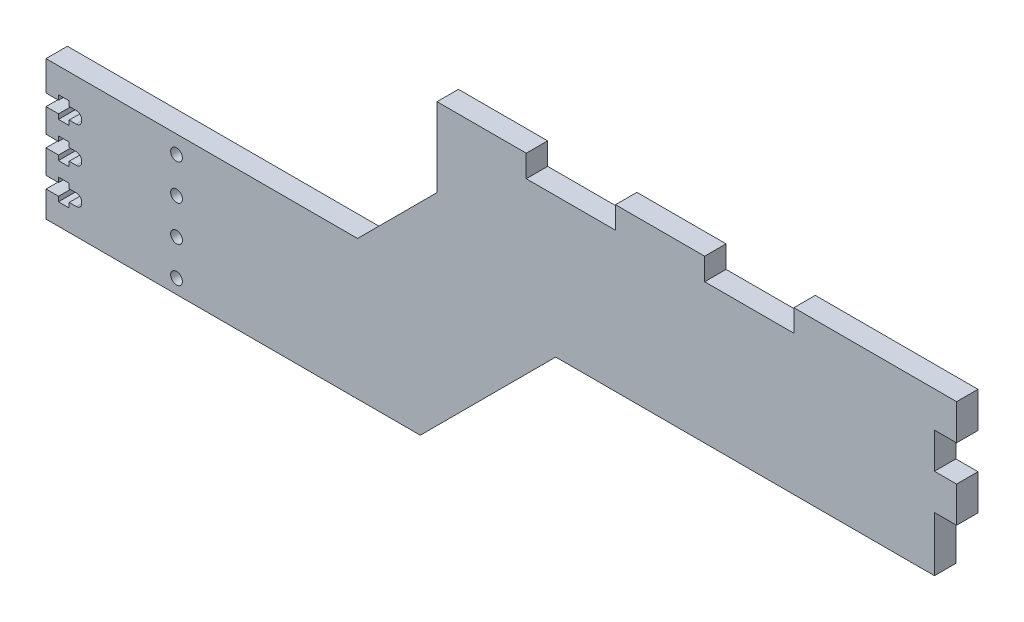
from build123d import *

# Parameters (mm, degrees)
EXTRUDE_1_DEPTH     = 6
SKETCH_2_R          = 1.65
CUT_EXTRUDE_1_DEPTH = 171.71260254


with BuildPart() as part:
    # Эскиз1 → Бобышка-Вытянуть1 (new body)
    with BuildSketch(Plane.XY):
        Polygon((-164.468308742, 1.015256317), (-164.468308742, -37.946418867), (-59.578582118, -37.946418867), (-21.632163251, 0), (84.510530021, 0), (84.510530021, 15.353810043), (90.710530021, 15.353810043), (90.710530021, 25.353810043), (84.510530021, 25.353810043), (84.510530021, 35.353810043), (90.710530021, 35.353810043), (90.710530021, 45.353810043), (45.113947205, 45.353810043), (45.113947205, 39.153810043), (20.113947205, 39.153810043), (20.113947205, 45.353810043), (-4.886052795, 45.353810043), (-4.886052795, 39.153810043), (-29.886052795, 39.153810043), (-29.886052795, 45.353810043), (-54.886052795, 45.353810043), (-54.886052795, 23.298924803), (-77.169721281, 1.015256317), align=None)
    extrude(amount=EXTRUDE_1_DEPTH)

    # Эскиз2 → Вырез-Вытянуть1 (cut, through all)
    with BuildSketch(Plane.XY.offset(6)):
        with Locations((-127.888308742, -3.984743683)):
            Circle(SKETCH_2_R)
        with Locations((-127.888308742, -13.984743683)):
            Circle(SKETCH_2_R)
        with Locations((-127.888308742, -23.984743683)):
            Circle(SKETCH_2_R)
        with Locations((-127.888308742, -33.984743683)):
            Circle(SKETCH_2_R)
        with BuildLine():
            Line((-157.968308742, -10.634743683), (-157.968308742, -11.984743683))
            Line((-157.968308742, -11.984743683), (-160.968308742, -11.984743683))
            Line((-160.968308742, -11.984743683), (-160.968308742, -10.634743683))
            Line((-160.968308742, -10.634743683), (-164.468308742, -10.634743683))
            Line((-164.468308742, -10.634743683), (-164.468308742, -7.334743683))
            Line((-164.468308742, -7.334743683), (-160.968308742, -7.334743683))
            Line((-160.968308742, -7.334743683), (-160.968308742, -5.984743683))
            Line((-160.968308742, -5.984743683), (-157.968308742, -5.984743683))
            Line((-157.968308742, -5.984743683), (-157.968308742, -7.334743683))
            Line((-157.968308742, -7.334743683), (-155.968308742, -7.334743683))
            ThreePointArc((-155.968308742, -7.334743683), (-154.90764857, -7.774083512), (-154.468308742, -8.834743683))
            Line((-154.468308742, -8.834743683), (-154.468308742, -9.134743683))
            ThreePointArc((-154.468308742, -9.134743683), (-154.90764857, -10.195403855), (-155.968308742, -10.634743683))
            Line((-155.968308742, -10.634743683), (-157.968308742, -10.634743683))
        make_face()
        with BuildLine():
            Line((-157.968308742, -17.334743683), (-155.968308742, -17.334743683))
            ThreePointArc((-155.968308742, -17.334743683), (-154.90764857, -17.774083512), (-154.468308742, -18.834743683))
            Line((-154.468308742, -18.834743683), (-154.468308742, -19.134743683))
            ThreePointArc((-154.468308742, -19.134743683), (-154.90764857, -20.195403855), (-155.968308742, -20.634743683))
            Line((-155.968308742, -20.634743683), (-157.968308742, -20.634743683))
            Line((-157.968308742, -20.634743683), (-157.968308742, -21.984743683))
            Line((-157.968308742, -21.984743683), (-160.968308742, -21.984743683))
            Line((-160.968308742, -21.984743683), (-160.968308742, -20.634743683))
            Line((-160.968308742, -20.634743683), (-164.468308742, -20.634743683))
            Line((-164.468308742, -20.634743683), (-164.468308742, -17.334743683))
            Line((-164.468308742, -17.334743683), (-160.968308742, -17.334743683))
            Line((-160.968308742, -17.334743683), (-160.968308742, -15.984743683))
            Line((-160.968308742, -15.984743683), (-157.968308742, -15.984743683))
            Line((-157.968308742, -15.984743683), (-157.968308742, -17.334743683))
        make_face()
        with BuildLine():
            Line((-160.968308742, -25.984743683), (-157.968308742, -25.984743683))
            Line((-157.968308742, -25.984743683), (-157.968308742, -27.334743683))
            Line((-157.968308742, -27.334743683), (-155.968308742, -27.334743683))
            ThreePointArc((-155.968308742, -27.334743683), (-154.90764857, -27.774083512), (-154.468308742, -28.834743683))
            Line((-154.468308742, -28.834743683), (-154.468308742, -29.134743683))
            ThreePointArc((-154.468308742, -29.134743683), (-154.90764857, -30.195403855), (-155.968308742, -30.634743683))
            Line((-155.968308742, -30.634743683), (-157.968308742, -30.634743683))
            Line((-157.968308742, -30.634743683), (-157.968308742, -31.984743683))
            Line((-157.968308742, -31.984743683), (-160.968308742, -31.984743683))
            Line((-160.968308742, -31.984743683), (-160.968308742, -30.634743683))
            Line((-160.968308742, -30.634743683), (-164.468308742, -30.634743683))
            Line((-164.468308742, -30.634743683), (-164.468308742, -27.334743683))
            Line((-164.468308742, -27.334743683), (-160.968308742, -27.334743683))
            Line((-160.968308742, -27.334743683), (-160.968308742, -25.984743683))
        make_face()
    extrude(amount=-CUT_EXTRUDE_1_DEPTH, mode=Mode.SUBTRACT)


solid = part.part
